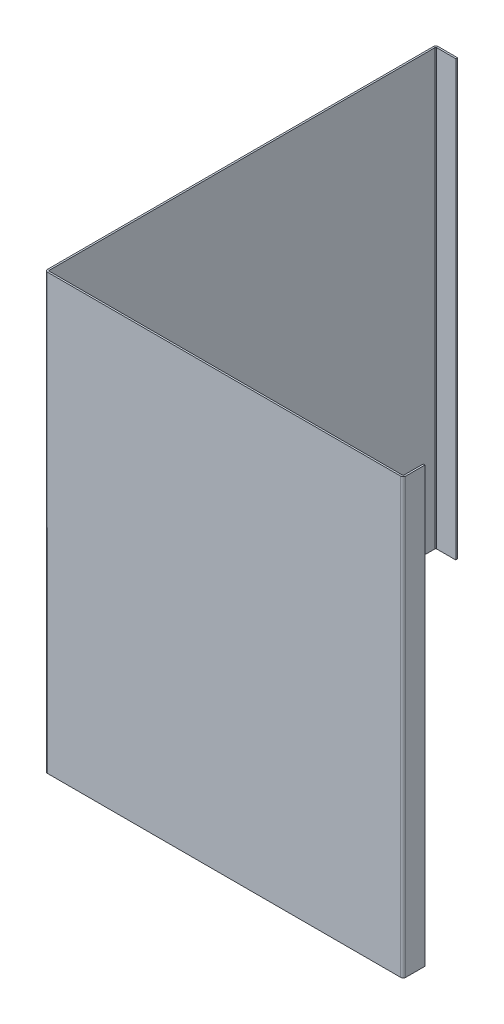
from build123d import *

# Parameters (mm, degrees)
SKETCH1_W                      = 1.5875
SKETCH1_H                      = 400
BASE_FLANGE1_DEPTH             = 360
EDGE_FLANGE1_STRIP_W           = 7.8232
EDGE_FLANGE1_STRIP_H           = 1.5875
EDGE_FLANGE1_STRIP_CUT_DEPTH   = 400
EDGE_FLANGE1_DEPTH             = 400
EDGE_FLANGE2_STRIP_W           = 7.8232
EDGE_FLANGE2_STRIP_H           = 1.5875
EDGE_FLANGE2_STRIP_CUT_DEPTH   = 400
EDGE_FLANGE2_STRIP_2_W         = 7.8232
EDGE_FLANGE2_STRIP_2_H         = 1.5875
EDGE_FLANGE2_STRIP_CUT_2_DEPTH = 400
EDGE_FLANGE2_DEPTH             = 400
EDGE_FLANGE2_BEND_DEPTH        = 400


# Sheet-metal steps are written as plain solids
with BuildPart() as part:
    # Sketch1 → Base-Flange1 (new body)
    with BuildSketch(Plane.XY):
        with Locations((0.79375, 0)):
            Rectangle(SKETCH1_W, SKETCH1_H)
    extrude(amount=BASE_FLANGE1_DEPTH)

    # Edge-Flange1 strip (across the edge) → Edge-Flange1 strip cut (cut)
    with BuildSketch(Plane(origin=(1.5875, 200, 360), x_dir=(0, 0, -1), z_dir=(0, -1, 0))):
        with Locations((-1.5875, -0.79375)):
            Rectangle(EDGE_FLANGE1_STRIP_W, EDGE_FLANGE1_STRIP_H)
    extrude(amount=EDGE_FLANGE1_STRIP_CUT_DEPTH, mode=Mode.SUBTRACT)

    # Edge-Flange1 section (across the edge) → Edge-Flange1 (add)
    with BuildSketch(Plane(origin=(1.5875, 200, 360), x_dir=(0, 0, -1), z_dir=(0, -1, 0))):
        with BuildLine():
            Line((0, 0.7366), (0, 328.4125))
            Line((0, 328.4125), (1.5875, 328.4125))
            Line((1.5875, 328.4125), (1.5875, 0.7366))
            ThreePointArc((1.5875, 0.7366), (1.803245145, 0.215745145), (2.3241, 0))
            Line((2.3241, 0), (2.3241, -1.5875))
            ThreePointArc((2.3241, -1.5875), (0.68071313, -0.90678687), (0, 0.7366))
        make_face()
    extrude(amount=EDGE_FLANGE1_DEPTH)

    # Edge-Flange2 strip (across the edge) → Edge-Flange2 strip cut (cut)
    with BuildSketch(Plane(origin=(330, 200, 358.4125), x_dir=(-1, 0, 0), z_dir=(0, -1, 0))):
        with Locations((-1.5875, -0.79375)):
            Rectangle(EDGE_FLANGE2_STRIP_W, EDGE_FLANGE2_STRIP_H)
    extrude(amount=EDGE_FLANGE2_STRIP_CUT_DEPTH, mode=Mode.SUBTRACT)

    # Edge-Flange2 strip 2 (across the edge) → Edge-Flange2 strip cut 2 (cut)
    with BuildSketch(Plane(origin=(1.5875, -200, 0), x_dir=(0, 0, 1), z_dir=(0, 1, 0))):
        with Locations((-1.5875, -0.79375)):
            Rectangle(EDGE_FLANGE2_STRIP_2_W, EDGE_FLANGE2_STRIP_2_H)
    extrude(amount=EDGE_FLANGE2_STRIP_CUT_2_DEPTH, mode=Mode.SUBTRACT)

    # Edge-Flange2 section (across the edge) → Edge-Flange2 (add)
    with BuildSketch(Plane(origin=(330, 200, 358.4125), x_dir=(-1, 0, 0), z_dir=(0, -1, 0))):
        with BuildLine():
            Line((0, 0.7366), (0, 18.4125))
            Line((0, 18.4125), (1.5875, 18.4125))
            Line((1.5875, 18.4125), (1.5875, 0.7366))
            ThreePointArc((1.5875, 0.7366), (1.803245145, 0.215745145), (2.3241, 0))
            Line((2.3241, 0), (2.3241, -1.5875))
            ThreePointArc((2.3241, -1.5875), (0.68071313, -0.90678687), (0, 0.7366))
        make_face()
    extrude(amount=EDGE_FLANGE2_DEPTH)

    # Edge-Flange2 section 2 (across the edge) → Edge-Flange2 bend (add)
    with BuildSketch(Plane(origin=(1.5875, -200, 0), x_dir=(0, 0, 1), z_dir=(0, 1, 0))):
        with BuildLine():
            Line((0, 0.7366), (0, 18.4125))
            Line((0, 18.4125), (1.5875, 18.4125))
            Line((1.5875, 18.4125), (1.5875, 0.7366))
            ThreePointArc((1.5875, 0.7366), (1.803245145, 0.215745145), (2.3241, 0))
            Line((2.3241, 0), (2.3241, -1.5875))
            ThreePointArc((2.3241, -1.5875), (0.68071313, -0.90678687), (0, 0.7366))
        make_face()
    extrude(amount=EDGE_FLANGE2_BEND_DEPTH)


solid = part.part
